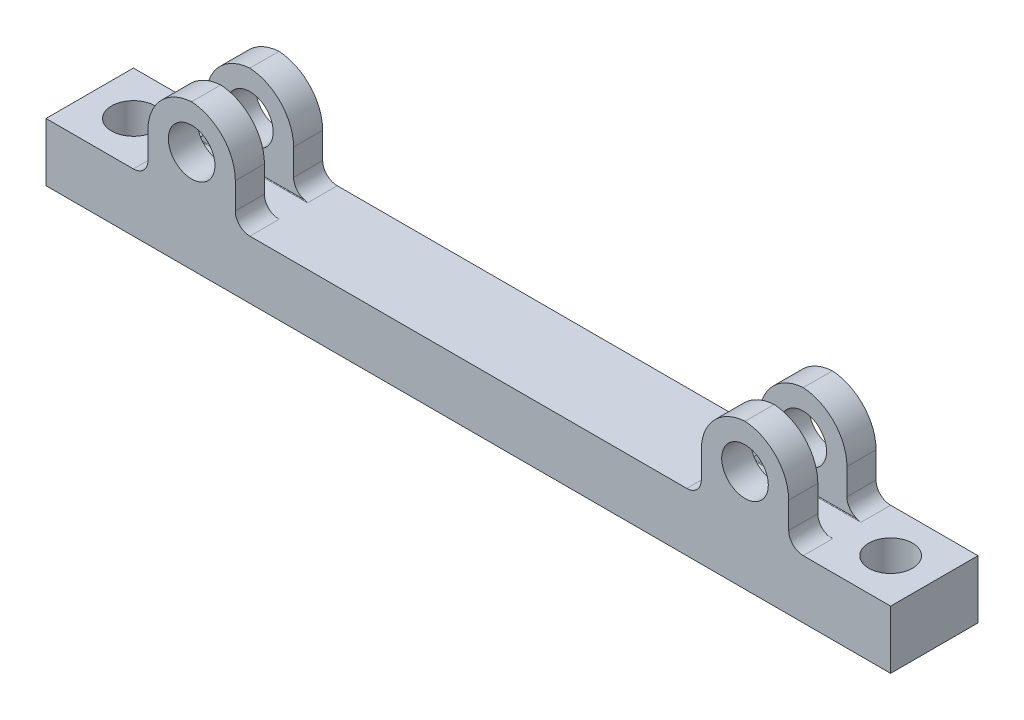
from build123d import *

# Parameters (mm, degrees)
SKETCH1_R           = 2.032
BOSS_EXTRUDE1_DEPTH = 7.62
SKETCH3_W           = 2.54
SKETCH3_H           = 7.62
CUT_EXTRUDE1_DEPTH  = 55.88
FILLET2_R           = 4.064
SKETCH5_W           = 8.89
SKETCH5_H           = 7.62
SKETCH5_R           = 1.905
BOSS_EXTRUDE2_DEPTH = 5.08
FILLET3_R           = 1.27
FILLET4_R           = 0.0508


with BuildPart() as part:
    # Sketch1 → Boss-Extrude1 (new body)
    with BuildSketch(Plane.XY):
        Polygon((0, 0), (0, 12.7), (7.62, 12.7), (7.62, 5.08), (48.26, 5.08), (48.26, 12.7), (55.88, 12.7), (55.88, 0), align=None)
        with Locations((3.81, 8.89)):
            Circle(SKETCH1_R, mode=Mode.SUBTRACT)
        with Locations((52.07, 8.89)):
            Circle(SKETCH1_R, mode=Mode.SUBTRACT)
    extrude(amount=-BOSS_EXTRUDE1_DEPTH)

    # Sketch3 → Cut-Extrude1 (cut)
    with BuildSketch(Plane(origin=(55.88, 0, 0), x_dir=(0, 0, -1), z_dir=(1, 0, 0))):
        with Locations((3.81, 8.89)):
            Rectangle(SKETCH3_W, SKETCH3_H)
    extrude(amount=-CUT_EXTRUDE1_DEPTH, mode=Mode.SUBTRACT)

    # Fillet2
    # the kernel refuses this fillet: 4.064 mm, written as the material it takes off along each edge
    with BuildSketch(Plane(origin=(48.26, 12.7, 5.08), x_dir=(0, -1, 0), z_dir=(0, 0, -1)), Plane(origin=(48.26, 12.7, 10.16), x_dir=(0, -1, 0), z_dir=(0, 0, -1)), Plane(origin=(7.62, 12.7, 5.08), x_dir=(-1, 0, 0), z_dir=(0, 0, -1)), Plane(origin=(7.62, 12.7, 10.16), x_dir=(-1, 0, 0), z_dir=(0, 0, -1)), Plane(origin=(55.88, 12.7, 10.16), x_dir=(-1, 0, 0), z_dir=(0, 0, -1)), Plane(origin=(0, 12.7, 5.08), x_dir=(0, -1, 0), z_dir=(0, 0, -1)), Plane(origin=(0, 12.7, 10.16), x_dir=(0, -1, 0), z_dir=(0, 0, -1))) as fillet2_piece_1:
        with BuildLine():
            CenterArc((FILLET2_R, -FILLET2_R), FILLET2_R, 90, 90)
            Line((0, -FILLET2_R), (0, 0))
            Line((0, 0), (FILLET2_R, 0))
        make_face()
    extrude(amount=22.86, mode=Mode.SUBTRACT)
    with BuildSketch(Plane(origin=(55.88, 12.7, 5.08), x_dir=(0, -1, 0), z_dir=(0, 0, -1))) as fillet2_piece_2:
        with BuildLine():
            CenterArc((FILLET2_R, FILLET2_R), FILLET2_R, 180, 90)
            Line((0, FILLET2_R), (0, 0))
            Line((0, 0), (FILLET2_R, 0))
        make_face()
    extrude(amount=22.86, mode=Mode.SUBTRACT)

    # Sketch5 → Boss-Extrude2 (add)
    # profile 1 of 2: a face of its own
    with BuildSketch(Plane(origin=(0, 0, 0), x_dir=(1, 0, 0), z_dir=(0, 1, 0))):
        with Locations((-4.445, 3.81)):
            Rectangle(SKETCH5_W, SKETCH5_H)
        with Locations(Location((-5.08, 3.81, 0), (0, 0, 270))):
            Circle(SKETCH5_R, mode=Mode.SUBTRACT)
    # profile 2 of 2: a face of its own
    with BuildSketch(Plane(origin=(0, 0, 0), x_dir=(1, 0, 0), z_dir=(0, 1, 0))):
        with Locations((60.325, 3.81)):
            Rectangle(SKETCH5_W, SKETCH5_H)
        with Locations(Location((60.96, 3.81, 0), (0, 0, 270))):
            Circle(SKETCH5_R, mode=Mode.SUBTRACT)
    extrude(amount=BOSS_EXTRUDE2_DEPTH)

    # Fillet3
    fillet3_edges = [part.edges().sort_by_distance(p)[0] for p in [
        (0, 5.08, -1.27),
        (0, 5.08, -6.35),
        (55.88, 5.08, -6.35),
        (55.88, 5.08, -1.27),
        (7.62, 5.08, -6.35),
        (48.26, 5.08, -6.35),
        (48.26, 5.08, -1.27),
        (7.62, 5.08, -1.27),
    ]]
    fillet(fillet3_edges, radius=FILLET3_R)

    # Fillet4
    fillet4_edges = [part.edges().sort_by_distance(p)[0] for p in [
        (3.81, 5.08, -5.08),
        (3.81, 5.08, -2.54),
        (52.07, 5.08, -2.54),
        (52.07, 5.08, -5.08),
    ]]
    fillet(fillet4_edges, radius=FILLET4_R)


solid = part.part
